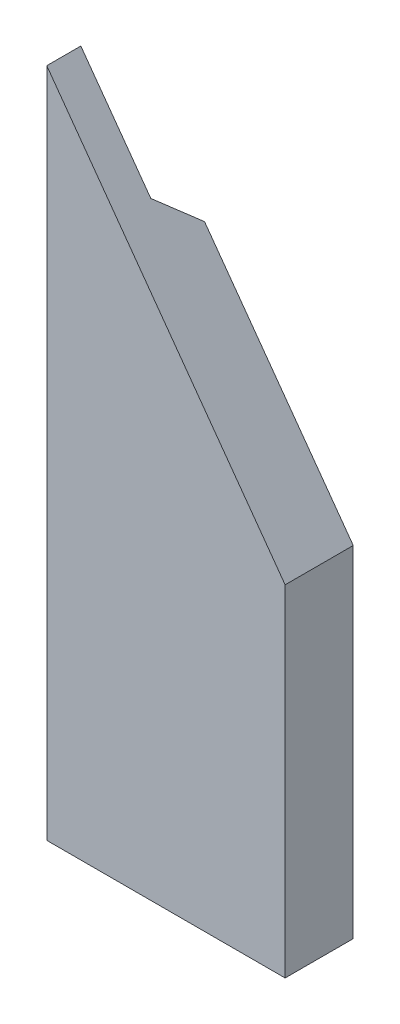
from build123d import *

# Parameters (mm, degrees)
SHAPE_DEPTH        = 800
CUT_EXTRUDE5_REACH = 804.449


with BuildPart() as part:
    # Sketch1 → Shape (new body)
    with BuildSketch(Plane(origin=(0, 0, 0), x_dir=(1, 0, 0), z_dir=(0, 1, 0))):
        Polygon((-41.5, 0), (-60, 0), (-60, -9), (50.5, -9), (50.5, 0), (60, 0), (54.803847577, 9), (-36.303847577, 9), align=None)
    extrude(amount=SHAPE_DEPTH)

    # Sketch7 → Cut-Extrude5 (cut, up to next)
    with BuildSketch(Plane.XY.offset(9), mode=Mode.PRIVATE) as cut_extrude5_sk1:
        Polygon((-60, 800), (-60, 177.326732673), (3, 90), (3, 0), (60, 0), (60, 800), align=None)
    cut_extrude5_tool1 = extrude(cut_extrude5_sk1.sketch, amount=-CUT_EXTRUDE5_REACH, mode=Mode.PRIVATE) & part.part
    add(cut_extrude5_tool1.solids().sort_by_distance((3.070088, 431.805757, 9))[0], mode=Mode.SUBTRACT)


solid = part.part
